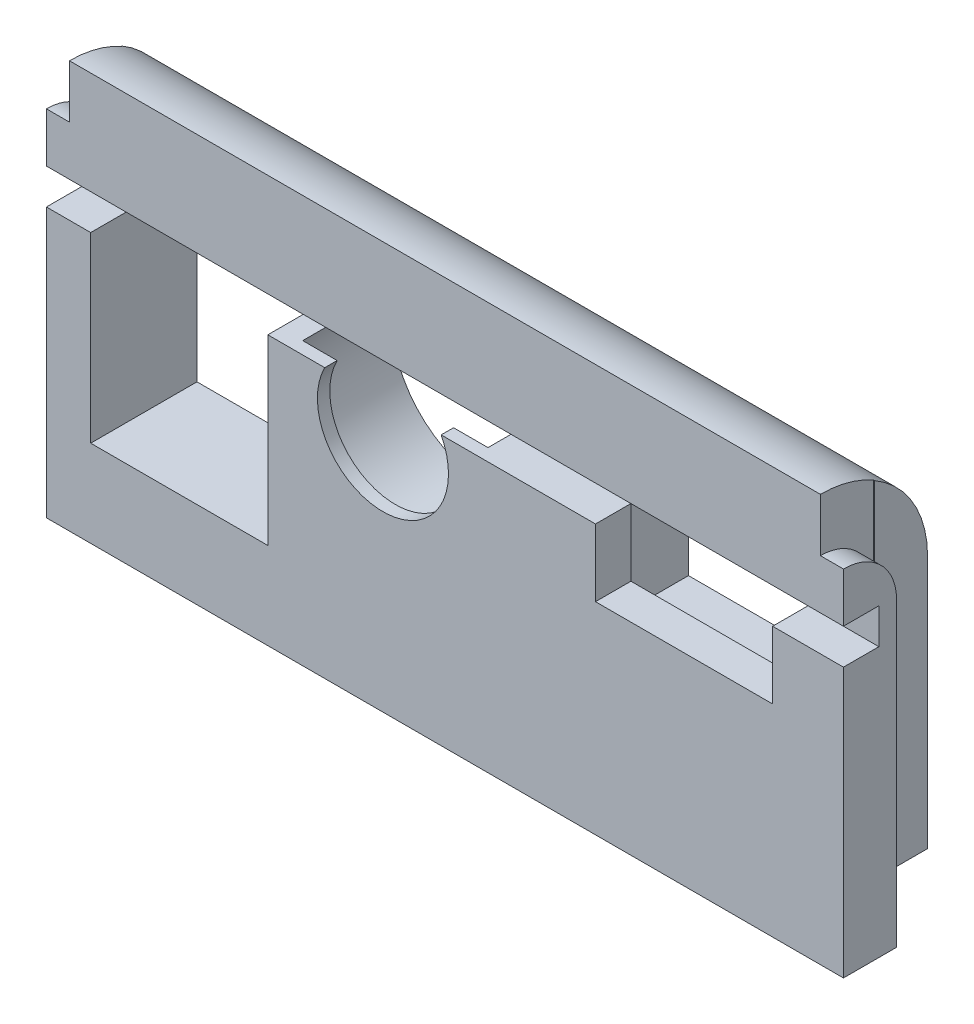
from build123d import *

# Parameters (mm, degrees)
ESQUISSE1_W             = 45
ESQUISSE1_H             = 23
BOSS_EXTRU_1_DEPTH      = 6
ENL_V_MAT_EXTRU_1_DEPTH = 3
CONG_1_R                = 6
ENL_V_MAT_EXTRU_3_DEPTH = 1.3
ESQUISSE7_W             = 45
ESQUISSE7_H             = 2
ENL_V_MAT_EXTRU_4_DEPTH = 2
ESQUISSE8_R             = 5.5
ESQUISSE8_W             = 10
ESQUISSE8_H             = 11.05
ESQUISSE8_H_2           = 4.3
ENL_V_MAT_EXTRU_5_DEPTH = 51.8920426
ESQUISSE9_W             = 11.5
ESQUISSE9_H             = 8.5
ENL_V_MAT_EXTRU_6_DEPTH = 4
BOSS_EXTRU_2_DEPTH      = 0.7
ESQUISSE12_R            = 3.7
ENL_V_MAT_EXTRU_8_DEPTH = 1


with BuildPart() as part:
    # Esquisse1 → Boss.-Extru.1 (new body)
    with BuildSketch(Plane.XY):
        with Locations((-22.5, 11.5)):
            Rectangle(ESQUISSE1_W, ESQUISSE1_H)
    extrude(amount=BOSS_EXTRU_1_DEPTH)

    # Esquisse2 → Enlèv. mat.-Extru.1 (cut)
    with BuildSketch(Plane(origin=(0, 0, 0), x_dir=(-1, 0, 0), z_dir=(0, 0, -1))):
        Polygon((0, 23), (1.25, 23), (1.25, 2.7), (43.75, 2.7), (43.75, 23), (45, 23), (45, 0), (0, 0), align=None)
    extrude(amount=-ENL_V_MAT_EXTRU_1_DEPTH, mode=Mode.SUBTRACT)

    # Congé1
    cong_1_edges = [part.edges().sort_by_distance(p)[0] for p in [
        (-22.5, 23, 0),
    ]]
    fillet(cong_1_edges, radius=CONG_1_R - 0.0001)  # a hair under: the kernel refuses the full size

    # Esquisse6 → Enlèv. mat.-Extru.3 (cut)
    with BuildSketch(Plane(origin=(0, 0, 0), x_dir=(0, 0, -1), z_dir=(1, 0, 0))):
        with BuildLine():
            Line((-3, 17), (-3, 23.616482957))
            Line((-3, 23.616482957), (-6, 23.616482957))
            Line((-6, 23.616482957), (-6, 20))
            ThreePointArc((-6, 20), (-3.878679656, 19.121320344), (-3, 17))
        make_face()
    enl_v_mat_extru_3 = extrude(amount=-ENL_V_MAT_EXTRU_3_DEPTH, mode=Mode.SUBTRACT)

    # Symétrie2: Enlèv. mat.-Extru.3 across plane
    add(enl_v_mat_extru_3.mirror(Plane.ZY.offset(22.5)), mode=Mode.SUBTRACT)

    # Esquisse7 → Enlèv. mat.-Extru.4 (cut)
    with BuildSketch(Plane.XY.offset(6)):
        with Locations((-22.5, 16.2)):
            Rectangle(ESQUISSE7_W, ESQUISSE7_H)
    extrude(amount=-ENL_V_MAT_EXTRU_4_DEPTH, mode=Mode.SUBTRACT)

    # Esquisse8 → Enlèv. mat.-Extru.5 (cut, through all)
    with BuildSketch(Plane.XY.offset(6)):
        with Locations(Location((-26, 13.5, 0), (0, 0, 18.004453))):
            Circle(ESQUISSE8_R)
        with Locations((-37.5, 10.425)):
            Rectangle(ESQUISSE8_W, ESQUISSE8_H)
        with Locations((-9, 13.55)):
            Rectangle(ESQUISSE8_W, ESQUISSE8_H_2)
    extrude(amount=-ENL_V_MAT_EXTRU_5_DEPTH, mode=Mode.SUBTRACT)

    # Esquisse9 → Enlèv. mat.-Extru.6 (cut)
    with BuildSketch(Plane(origin=(0, 0, 0), x_dir=(-1, 0, 0), z_dir=(0, 0, -1))):
        with Locations((9, 13.55)):
            Rectangle(ESQUISSE9_W, ESQUISSE9_H)
    extrude(amount=-ENL_V_MAT_EXTRU_6_DEPTH, mode=Mode.SUBTRACT)

    # Esquisse10 → Boss.-Extru.2 (add)
    with BuildSketch(Plane.XY.offset(6)):
        with BuildLine():
            Line((-30.06939799, 17.2), (-21.93060201, 17.2))
            ThreePointArc((-21.93060201, 17.2), (-26, 19), (-30.06939799, 17.2))
        make_face()
        with BuildLine():
            Line((-31.230678732, 15.2), (-20.769321268, 15.2))
            ThreePointArc((-20.769321268, 15.2), (-26, 8), (-31.230678732, 15.2))
        make_face()
    extrude(amount=-BOSS_EXTRU_2_DEPTH)

    # Esquisse12 → Enlèv. mat.-Extru.8 (cut)
    with BuildSketch(Plane.XY.offset(6)):
        with Locations((-26, 13.5)):
            Circle(ESQUISSE12_R)
    extrude(amount=-ENL_V_MAT_EXTRU_8_DEPTH, mode=Mode.SUBTRACT)


solid = part.part
